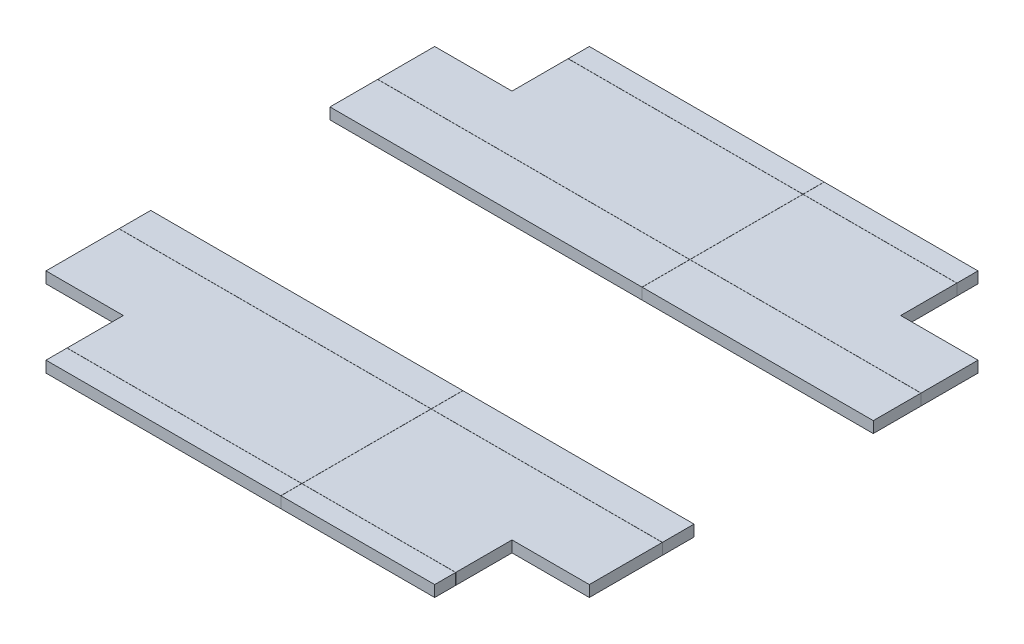
from build123d import *

# Parameters (mm, degrees)
SKETCH1_W                    = 4908.55
SKETCH1_H                    = 4908.55
BOSS_EXTRUDE1_DEPTH          = 101.6
SKETCH2_W                    = 4908.55
SKETCH2_H                    = 1619.25
CUT_EXTRUDE1_DEPTH           = 3473.355700566
SKETCH3_W                    = 698.5
SKETCH3_H                    = 698.5
CUT_EXTRUDE2_DEPTH           = 3473.355700566
SKETCH4_W                    = 3511.55
SKETCH4_H                    = 1.27
SKETCH4_W_2                  = 4915.761641318
SKETCH4_W_3                  = 4908.55
CUT_EXTRUDE_THIN1_DEPTH      = 3473.355700566
CUT_EXTRUDE_THIN2_DEPTH      = 3473.355700566
CUT_EXTRUDE_THIN2_DEPTH_BACK = 3473.355700566
SKETCH5_W                    = 1.27
SKETCH5_H                    = 4908.55


with BuildPart() as part:
    # Sketch1 → Boss-Extrude1 (new body)
    with BuildSketch(Plane(origin=(0, 0, 0), x_dir=(1, 0, 0), z_dir=(0, 1, 0))):
        Rectangle(SKETCH1_W, SKETCH1_H)
    extrude(amount=BOSS_EXTRUDE1_DEPTH)

    # Sketch2 → Cut-Extrude1 (cut, through all)
    with BuildSketch(Plane(origin=(0, 101.6, 0), x_dir=(1, 0, 0), z_dir=(0, 1, 0))):
        Rectangle(SKETCH2_W, SKETCH2_H)
    extrude(amount=-CUT_EXTRUDE1_DEPTH, mode=Mode.SUBTRACT)


with BuildPart() as cut_extrude1_piece_1:
    # of the separate pieces the step leaves, piece 1, a body of its own (cut_extrude1_pieces)
    add(part.part.solids().sort_by_distance((-2454.275, 0, -2454.275))[0])


with BuildPart() as cut_extrude1_piece_2:
    # of the separate pieces the step leaves, piece 2, a body of its own (cut_extrude1_pieces)
    add(part.part.solids().sort_by_distance((-2454.275, 0, 2454.275))[0])


with BuildPart() as cut_extrude2_tool:
    # Sketch3 → Cut-Extrude2 (new, through all)
    with BuildSketch(Plane(origin=(0, 101.6, 0), x_dir=(1, 0, 0), z_dir=(0, 1, 0))):
        with Locations((-2105.025, -2105.025)):
            Rectangle(SKETCH3_W, SKETCH3_H)
        with Locations((2105.025, -2105.025)):
            Rectangle(SKETCH3_W, SKETCH3_H)
        with Locations((-2105.025, 2105.025)):
            Rectangle(SKETCH3_W, SKETCH3_H)
        with Locations((2105.025, 2105.025)):
            Rectangle(SKETCH3_W, SKETCH3_H)
    extrude(amount=-CUT_EXTRUDE2_DEPTH)


with BuildPart() as cut_extrude1_piece_1_1:
    add(cut_extrude1_piece_1.part)

    # Cut-Extrude2: cut by cut_extrude2_tool
    add(cut_extrude2_tool.part, mode=Mode.SUBTRACT)


with BuildPart() as cut_extrude1_piece_2_1:
    add(cut_extrude1_piece_2.part)

    # Cut-Extrude2: cut by cut_extrude2_tool
    add(cut_extrude2_tool.part, mode=Mode.SUBTRACT)


with BuildPart() as cut_extrude_thin1_tool:
    # Sketch4 → Cut-Extrude-Thin1 (new, through all)
    with BuildSketch(Plane(origin=(0, 101.6, 0), x_dir=(1, 0, 0), z_dir=(0, 1, 0))):
        with Locations((0, -2264.41)):
            Rectangle(SKETCH4_W, SKETCH4_H)
        with Locations((3.605820659, -1096.01)):
            Rectangle(SKETCH4_W_2, SKETCH4_H)
        with Locations((0, 2263.14)):
            Rectangle(SKETCH4_W, SKETCH4_H)
        with Locations((0, 1240.79)):
            Rectangle(SKETCH4_W_3, SKETCH4_H)
    extrude(amount=-CUT_EXTRUDE_THIN1_DEPTH)


with BuildPart() as cut_extrude1_piece_1_2:
    add(cut_extrude1_piece_1_1.part)

    # Cut-Extrude-Thin1: cut by cut_extrude_thin1_tool
    add(cut_extrude_thin1_tool.part, mode=Mode.SUBTRACT)


with BuildPart() as cut_extrude1_piece_2_2:
    add(cut_extrude1_piece_2_1.part)

    # Cut-Extrude-Thin1: cut by cut_extrude_thin1_tool
    add(cut_extrude_thin1_tool.part, mode=Mode.SUBTRACT)


with BuildPart() as cut_extrude_thin1_piece_1:
    # of the separate pieces the step leaves, piece 1, a body of its own (cut_extrude_thin1_pieces)
    add(cut_extrude1_piece_1_2.part.solids().sort_by_distance((2454.275, 0, -1755.775))[0])


with BuildPart() as cut_extrude_thin1_piece_2:
    # of the separate pieces the step leaves, piece 2, a body of its own (cut_extrude_thin1_pieces)
    add(cut_extrude1_piece_1_2.part.solids().sort_by_distance((2454.275, 0, -1240.155))[0])


with BuildPart() as cut_extrude_thin1_piece_3:
    # of the separate pieces the step leaves, piece 3, a body of its own (cut_extrude_thin1_pieces)
    add(cut_extrude1_piece_1_2.part.solids().sort_by_distance((-1755.775, 0, -2454.275))[0])


with BuildPart() as cut_extrude_thin1_piece_1_of_cut_extrude:
    # of the separate pieces the step leaves, piece 1, a body of its own (cut_extrude_thin1_pieces_of_cut_extrude1)
    add(cut_extrude1_piece_2_2.part.solids().sort_by_distance((-2454.275, 0, 1755.775))[0])


with BuildPart() as cut_extrude_thin1_piece_2_of_cut_extrude:
    # of the separate pieces the step leaves, piece 2, a body of its own (cut_extrude_thin1_pieces_of_cut_extrude1)
    add(cut_extrude1_piece_2_2.part.solids().sort_by_distance((-2454.275, 0, 1095.375))[0])


with BuildPart() as cut_extrude_thin1_piece_3_of_cut_extrude:
    # of the separate pieces the step leaves, piece 3, a body of its own (cut_extrude_thin1_pieces_of_cut_extrude1)
    add(cut_extrude1_piece_2_2.part.solids().sort_by_distance((-1755.775, 0, 2265.045))[0])


with BuildPart() as cut_extrude_thin2_tool:
    # Sketch5 → Cut-Extrude-Thin2 (new, two sides: drawn at the far end of the back side and taken through both)
    with BuildSketch(Plane(origin=(0, 101.6, 0), x_dir=(1, 0, 0), z_dir=(0, 1, 0)).offset(-CUT_EXTRUDE_THIN2_DEPTH_BACK)):
        with Locations((365.76, 0)):
            Rectangle(SKETCH5_W, SKETCH5_H)
    extrude(amount=CUT_EXTRUDE_THIN2_DEPTH + CUT_EXTRUDE_THIN2_DEPTH_BACK)


with BuildPart() as cut_extrude_thin1_piece_1_1:
    add(cut_extrude_thin1_piece_1.part)

    # Cut-Extrude-Thin2: cut by cut_extrude_thin2_tool
    add(cut_extrude_thin2_tool.part, mode=Mode.SUBTRACT)


with BuildPart() as cut_extrude_thin1_piece_2_1:
    add(cut_extrude_thin1_piece_2.part)

    # Cut-Extrude-Thin2: cut by cut_extrude_thin2_tool
    add(cut_extrude_thin2_tool.part, mode=Mode.SUBTRACT)


with BuildPart() as cut_extrude_thin1_piece_3_1:
    add(cut_extrude_thin1_piece_3.part)

    # Cut-Extrude-Thin2: cut by cut_extrude_thin2_tool
    add(cut_extrude_thin2_tool.part, mode=Mode.SUBTRACT)


with BuildPart() as cut_extrude_thin1_piece_1_of_cut_extrude_1:
    add(cut_extrude_thin1_piece_1_of_cut_extrude.part)

    # Cut-Extrude-Thin2: cut by cut_extrude_thin2_tool
    add(cut_extrude_thin2_tool.part, mode=Mode.SUBTRACT)


with BuildPart() as cut_extrude_thin1_piece_2_of_cut_extrude_1:
    add(cut_extrude_thin1_piece_2_of_cut_extrude.part)

    # Cut-Extrude-Thin2: cut by cut_extrude_thin2_tool
    add(cut_extrude_thin2_tool.part, mode=Mode.SUBTRACT)


with BuildPart() as cut_extrude_thin1_piece_3_of_cut_extrude_1:
    add(cut_extrude_thin1_piece_3_of_cut_extrude.part)

    # Cut-Extrude-Thin2: cut by cut_extrude_thin2_tool
    add(cut_extrude_thin2_tool.part, mode=Mode.SUBTRACT)


with BuildPart() as cut_extrude_thin2_piece_1:
    # of the separate pieces the step leaves, piece 1, a body of its own (cut_extrude_thin2_pieces)
    add(cut_extrude_thin1_piece_1_1.part.solids().sort_by_distance((365.125, 0, -1241.425))[0])


with BuildPart() as cut_extrude_thin2_piece_2:
    # of the separate pieces the step leaves, piece 2, a body of its own (cut_extrude_thin2_pieces)
    add(cut_extrude_thin1_piece_1_1.part.solids().sort_by_distance((2454.275, 0, -1755.775))[0])


with BuildPart() as cut_extrude_thin2_piece_1_of_cut_extrude:
    # of the separate pieces the step leaves, piece 1, a body of its own (cut_extrude_thin2_pieces_of_cut_extrude)
    add(cut_extrude_thin1_piece_2_1.part.solids().sort_by_distance((-2454.275, 0, -1240.155))[0])


with BuildPart() as cut_extrude_thin2_piece_2_of_cut_extrude:
    # of the separate pieces the step leaves, piece 2, a body of its own (cut_extrude_thin2_pieces_of_cut_extrude)
    add(cut_extrude_thin1_piece_2_1.part.solids().sort_by_distance((366.395, 0, -1240.155))[0])


with BuildPart() as cut_extrude_thin2_piece_1_of_cut_ext_2:
    # of the separate pieces the step leaves, piece 1, a body of its own (cut_extrude_thin2_pieces_of_cut_extr_2)
    add(cut_extrude_thin1_piece_3_1.part.solids().sort_by_distance((-1755.775, 0, -2454.275))[0])


with BuildPart() as cut_extrude_thin2_piece_2_of_cut_ext_2:
    # of the separate pieces the step leaves, piece 2, a body of its own (cut_extrude_thin2_pieces_of_cut_extr_2)
    add(cut_extrude_thin1_piece_3_1.part.solids().sort_by_distance((366.395, 0, -2454.275))[0])


with BuildPart() as cut_extrude_thin2_piece_1_of_cut_ext_3:
    # of the separate pieces the step leaves, piece 1, a body of its own (cut_extrude_thin2_pieces_of_cut_extr_3)
    add(cut_extrude_thin1_piece_1_of_cut_extrude_1.part.solids().sort_by_distance((-2454.275, 0, 1755.775))[0])


with BuildPart() as cut_extrude_thin2_piece_2_of_cut_ext_3:
    # of the separate pieces the step leaves, piece 2, a body of its own (cut_extrude_thin2_pieces_of_cut_extr_3)
    add(cut_extrude_thin1_piece_1_of_cut_extrude_1.part.solids().sort_by_distance((366.395, 0, 1096.645))[0])


with BuildPart() as cut_extrude_thin2_piece_1_of_cut_ext_4:
    # of the separate pieces the step leaves, piece 1, a body of its own (cut_extrude_thin2_pieces_of_cut_extr_4)
    add(cut_extrude_thin1_piece_2_of_cut_extrude_1.part.solids().sort_by_distance((-2454.275, 0, 1095.375))[0])


with BuildPart() as cut_extrude_thin2_piece_2_of_cut_ext_4:
    # of the separate pieces the step leaves, piece 2, a body of its own (cut_extrude_thin2_pieces_of_cut_extr_4)
    add(cut_extrude_thin1_piece_2_of_cut_extrude_1.part.solids().sort_by_distance((2454.275, 0, 809.625))[0])


with BuildPart() as cut_extrude_thin2_piece_1_of_cut_ext_5:
    # of the separate pieces the step leaves, piece 1, a body of its own (cut_extrude_thin2_pieces_of_cut_extr_5)
    add(cut_extrude_thin1_piece_3_of_cut_extrude_1.part.solids().sort_by_distance((-1755.775, 0, 2265.045))[0])


with BuildPart() as cut_extrude_thin2_piece_2_of_cut_ext_5:
    # of the separate pieces the step leaves, piece 2, a body of its own (cut_extrude_thin2_pieces_of_cut_extr_5)
    add(cut_extrude_thin1_piece_3_of_cut_extrude_1.part.solids().sort_by_distance((366.395, 0, 2265.045))[0])


solid = Compound([cut_extrude_thin2_piece_1.part, cut_extrude_thin2_piece_2.part, cut_extrude_thin2_piece_1_of_cut_extrude.part, cut_extrude_thin2_piece_2_of_cut_extrude.part, cut_extrude_thin2_piece_1_of_cut_ext_2.part, cut_extrude_thin2_piece_2_of_cut_ext_2.part, cut_extrude_thin2_piece_1_of_cut_ext_3.part, cut_extrude_thin2_piece_2_of_cut_ext_3.part, cut_extrude_thin2_piece_1_of_cut_ext_4.part, cut_extrude_thin2_piece_2_of_cut_ext_4.part, cut_extrude_thin2_piece_1_of_cut_ext_5.part, cut_extrude_thin2_piece_2_of_cut_ext_5.part])
